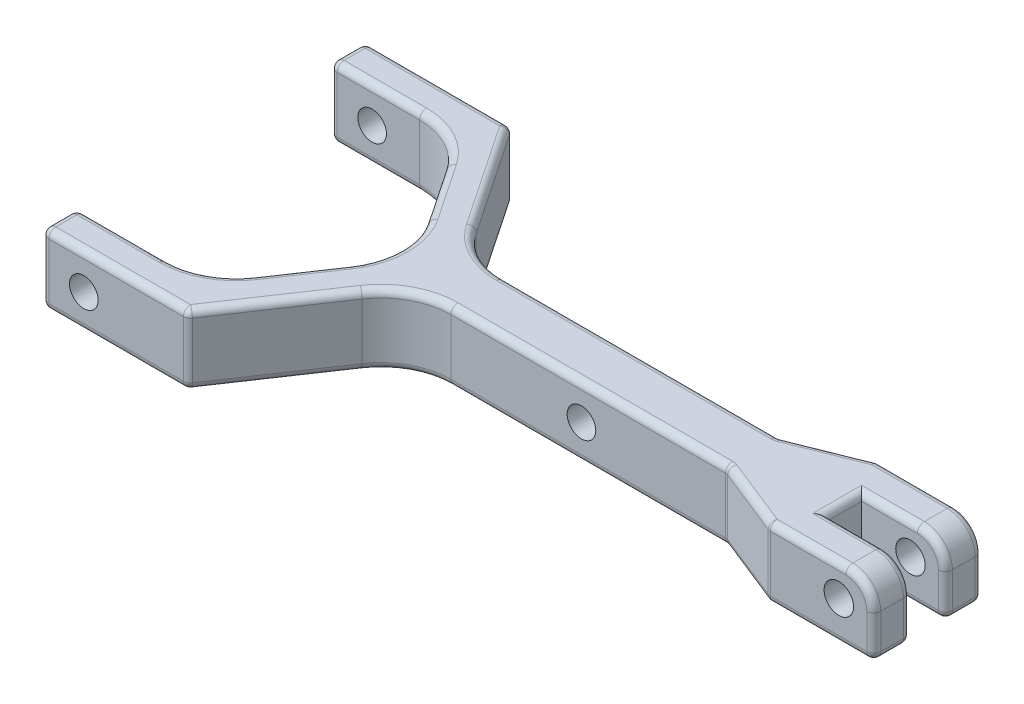
from build123d import *

# Parameters (mm, degrees)
ESQUISSE1_W             = 12.7
ESQUISSE1_H             = 12.7
BOSS_EXTRU_1_DEPTH      = 4.7625
ESQUISSE2_R             = 2.6
ENL_V_MAT_EXTRU_1_DEPTH = 14.090860361
ESQUISSE4_W             = 9.525
ESQUISSE4_H             = 12.7
BOSS_EXTRU_3_DEPTH      = 51.8414
ESQUISSE6_W             = 15.24
ESQUISSE6_H             = 6.35
ENL_V_MAT_EXTRU_3_DEPTH = 60.751237981
ESQUISSE7_W             = 9.525
ESQUISSE7_H             = 12.7
BOSS_EXTRU_4_DEPTH      = 28.575
BOSS_EXTRU_5_DEPTH      = 12.7
ESQUISSE10_R            = 2.6
ENL_V_MAT_EXTRU_4_DEPTH = 95.247476954
BOSS_EXTRU_6_DEPTH      = 12.7
ESQUISSE5_R             = 2.6797
ENL_V_MAT_EXTRU_2_DEPTH = 84.486616487
CONG_1_R                = 12.7
CONG_2_R                = 1.27
CONG_3_R                = 5.08


with BuildPart() as part:
    # Esquisse1 → Boss.-Extru.1 (new, symmetric)
    with BuildSketch(Plane.XY):
        Rectangle(ESQUISSE1_W, ESQUISSE1_H)
    extrude(amount=BOSS_EXTRU_1_DEPTH, both=True)

    # Esquisse2 → Enlèv. mat.-Extru.1 (cut, through all)
    with BuildSketch(Plane.XY.offset(4.7625)):
        Circle(ESQUISSE2_R)
    extrude(amount=-ENL_V_MAT_EXTRU_1_DEPTH, mode=Mode.SUBTRACT)

    # Esquisse4 → Boss.-Extru.3 (add)
    with BuildSketch(Plane(origin=(6.35, 0, 0), x_dir=(0, 0, -1), z_dir=(1, 0, 0))):
        Rectangle(ESQUISSE4_W, ESQUISSE4_H)
    extrude(amount=BOSS_EXTRU_3_DEPTH)

    # Esquisse6 → Enlèv. mat.-Extru.3 (cut, through all)
    with BuildSketch(Plane(origin=(0, 6.35, 0), x_dir=(1, 0, 0), z_dir=(0, 1, 0))):
        with Locations((50.5714, 0)):
            Rectangle(ESQUISSE6_W, ESQUISSE6_H)
    extrude(amount=-ENL_V_MAT_EXTRU_3_DEPTH, mode=Mode.SUBTRACT)

    # Esquisse7 → Boss.-Extru.4 (add)
    with BuildSketch(Plane.ZY.offset(6.35)):
        Rectangle(ESQUISSE7_W, ESQUISSE7_H)
    extrude(amount=BOSS_EXTRU_4_DEPTH)

    # Esquisse8 → Boss.-Extru.5 (add)
    with BuildSketch(Plane(origin=(0, 6.35, 0), x_dir=(1, 0, 0), z_dir=(0, 1, 0))):
        Polygon((-30.476156848, 4.7625), (-47.038708572, 29.36875), (-73.4314, 29.36875), (-73.4314, 23.01875), (-50.419, 23.01875), (-34.925, 0), (-50.419, -23.01875), (-73.4314, -23.01875), (-73.4314, -29.36875), (-47.038708572, -29.36875), (-30.476156848, -4.7625), align=None)
    extrude(amount=-BOSS_EXTRU_5_DEPTH)

    # Esquisse10 → Enlèv. mat.-Extru.4 (cut, through all)
    with BuildSketch(Plane.XY.offset(29.36875)):
        with Locations((-65.81534116, -0.103112023)):
            Circle(ESQUISSE10_R)
    extrude(amount=-ENL_V_MAT_EXTRU_4_DEPTH, mode=Mode.SUBTRACT)

    # Esquisse11 → Boss.-Extru.6 (add)
    with BuildSketch(Plane(origin=(0, 6.35, 0), x_dir=(1, 0, 0), z_dir=(0, 1, 0))):
        Polygon((58.1914, 9.8425), (58.1914, 4.7625), (26.4414, 4.7625), (39.1414, 9.8425), align=None)
        Polygon((26.4414, -4.7625), (39.1414, -9.8425), (58.1914, -9.8425), (58.1914, -4.7625), align=None)
    extrude(amount=-BOSS_EXTRU_6_DEPTH)

    # Esquisse5 → Enlèv. mat.-Extru.2 (cut, through all)
    with BuildSketch(Plane.XY.offset(9.8425)):
        with Locations((51.8414, 0.762)):
            Circle(ESQUISSE5_R)
    extrude(amount=-ENL_V_MAT_EXTRU_2_DEPTH, mode=Mode.SUBTRACT)

    # Congé1
    cong_1_edges = [part.edges().sort_by_distance(p)[0] for p in [
        (-30.476156848, 0, -4.7625),
        (-30.476156848, 0, 4.7625),
        (-50.419, 0, 23.01875),
        (-34.925, 0, 0),
        (-50.419, 0, -23.01875),
    ]]
    fillet(cong_1_edges, radius=CONG_1_R)

    # Congé2
    cong_2_edges = [part.edges().sort_by_distance(p)[0] for p in [
        (1.362913003, 6.35, -4.7625),
        (32.7914, -6.35, -7.3025),
        (26.4414, 0, -4.7625),
        (48.6664, -6.35, -9.8425),
        (58.1914, 0, -9.8425),
        (32.7914, 6.35, -7.3025),
        (48.6664, 6.35, -9.8425),
        (1.362913003, 6.35, 4.7625),
        (26.4414, 0, 4.7625),
        (48.6664, -6.35, 9.8425),
        (58.1914, 0, 9.8425),
        (32.7914, -6.35, 7.3025),
        (39.1414, 0, 9.8425),
        (32.7914, 6.35, 7.3025),
        (48.6664, 6.35, 9.8425),
        (-43.171154811, 6.35, -12.250947209),
        (-43.171154811, -6.35, -12.250947209),
        (-43.171154811, 6.35, 12.250947209),
        (-43.171154811, -6.35, 12.250947209),
        (-65.305491428, 6.35, 23.01875),
        (-65.305491428, -6.35, 23.01875),
        (1.362913003, -6.35, -4.7625),
        (-40.644958753, 6.35, -19.869838896),
        (-40.644958753, -6.35, -19.869838896),
        (1.362913003, -6.35, 4.7625),
        (-51.211876723, 6.35, -21.529302329),
        (-51.211876723, -6.35, -21.529302329),
        (-51.211876723, 6.35, 21.529302329),
        (-51.211876723, -6.35, 21.529302329),
        (-37.533996648, 6.35, 0),
        (-37.533996648, -6.35, 0),
        (-29.683280125, 6.35, -6.251947671),
        (-29.683280125, -6.35, -6.251947671),
        (-29.683280125, 6.35, 6.251947671),
        (-29.683280125, -6.35, 6.251947671),
        (58.1914, -6.35, 6.50875),
        (58.1914, -6.35, -6.50875),
        (58.1914, 0, -3.175),
        (50.5714, -6.35, 3.175),
        (58.1914, 0, 3.175),
        (42.9514, -6.35, 0),
        (50.5714, -6.35, -3.175),
        (50.5714, 6.35, -3.175),
        (42.9514, 6.35, 0),
        (50.5714, 6.35, 3.175),
        (-60.235054286, 6.35, -29.36875),
        (-73.4314, 6.35, -26.19375),
        (-65.305491428, 6.35, -23.01875),
        (-40.644958753, -6.35, 19.869838896),
        (-60.235054286, -6.35, 29.36875),
        (-47.038708572, 0, 29.36875),
        (-73.4314, -6.35, 26.19375),
        (-73.4314, 0, 29.36875),
        (-73.4314, 0, 23.01875),
        (-65.305491428, -6.35, -23.01875),
        (-73.4314, -6.35, -26.19375),
        (-73.4314, 0, -23.01875),
        (-60.235054286, -6.35, -29.36875),
        (-73.4314, 0, -29.36875),
        (-47.038708572, 0, -29.36875),
        (-40.644958753, 6.35, 19.869838896),
        (-73.4314, 6.35, 26.19375),
        (-60.235054286, 6.35, 29.36875),
        (-68.41534116, -0.103112023, 23.01875),
    ]]
    fillet(cong_2_edges, radius=CONG_2_R)

    # Congé3
    # the kernel refuses this fillet: 5.08 mm, written as the material it takes off along each edge
    with BuildSketch(Plane(origin=(53.1114, 1.27, -9.8425), x_dir=(0, 1, 0), z_dir=(-1, 0, 0))) as cong_3_piece_1:
        with BuildLine():
            CenterArc((3.81, -1.27), 1.27, 0, 90)
            Line((5.08, -1.27), (5.08, 0))
            Line((5.08, 0), (3.81, 0))
        make_face()
    revolve(axis=Axis((53.1114, 1.27, -9.8425), (0, 0, -1)), revolution_arc=90, mode=Mode.SUBTRACT)
    with BuildSketch(Plane(origin=(53.1114, 1.27, -3.175), x_dir=(1, 0, 0), z_dir=(0, -1, 0))) as cong_3_piece_2:
        with BuildLine():
            CenterArc((3.81, -1.27), 1.27, 0, 90)
            Line((5.08, -1.27), (5.08, 0))
            Line((5.08, 0), (3.81, 0))
        make_face()
    revolve(axis=Axis((53.1114, 1.27, -3.175), (0, 0, 1)), revolution_arc=90, mode=Mode.SUBTRACT)
    with BuildSketch(Plane(origin=(53.1114, 1.27, 3.175), x_dir=(0, 1, 0), z_dir=(-1, 0, 0))) as cong_3_piece_3:
        with BuildLine():
            CenterArc((3.81, -1.27), 1.27, 0, 90)
            Line((5.08, -1.27), (5.08, 0))
            Line((5.08, 0), (3.81, 0))
        make_face()
    revolve(axis=Axis((53.1114, 1.27, 3.175), (0, 0, -1)), revolution_arc=90, mode=Mode.SUBTRACT)
    with BuildSketch(Plane(origin=(53.1114, 1.27, 9.8425), x_dir=(1, 0, 0), z_dir=(0, -1, 0))) as cong_3_piece_4:
        with BuildLine():
            CenterArc((3.81, -1.27), 1.27, 0, 90)
            Line((5.08, -1.27), (5.08, 0))
            Line((5.08, 0), (3.81, 0))
        make_face()
    revolve(axis=Axis((53.1114, 1.27, 9.8425), (0, 0, 1)), revolution_arc=90, mode=Mode.SUBTRACT)
    with BuildSketch(Plane(origin=(58.1914, 6.35, -3.175), x_dir=(-1, 0, 0), z_dir=(0, 0, -1)), Plane(origin=(58.1914, 6.35, 9.8425), x_dir=(-1, 0, 0), z_dir=(0, 0, -1))) as cong_3_piece_5:
        with BuildLine():
            CenterArc((CONG_3_R, -CONG_3_R), CONG_3_R, 90, 90)
            Line((0, -CONG_3_R), (0, 0))
            Line((0, 0), (CONG_3_R, 0))
        make_face()
    extrude(amount=6.6675, mode=Mode.SUBTRACT)


solid = part.part
